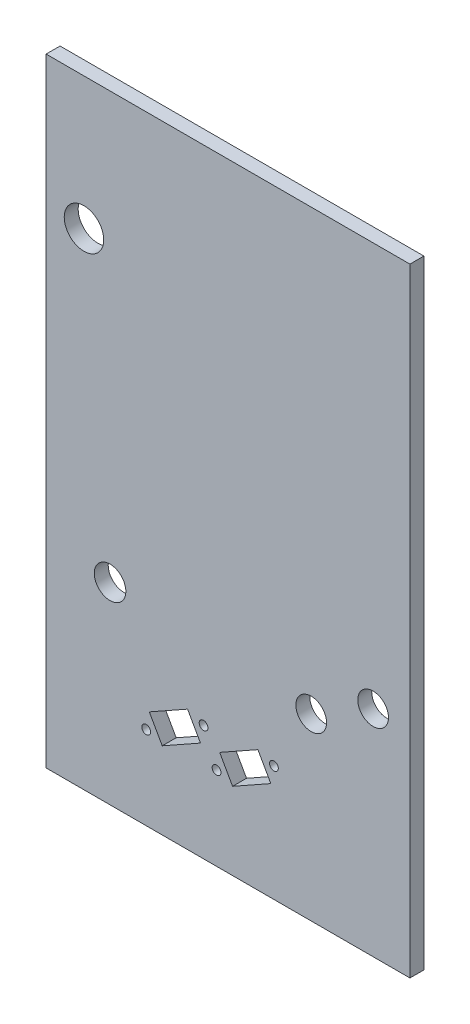
from build123d import *

# Parameters (mm, degrees)
SKETCH1_6_R         = 4.5
BEZEL_DEPTH         = 3.18
SKETCH1_W           = 89.29
SKETCH1_H           = 147.294272307
SKETCH1_R           = 1
SKETCH1_R_2         = 3.6
SKETCH1_R_3         = 3.5
BODY_DEPTH          = 3.18
BOSS_EXTRUDE1_DEPTH = 3.18
SKETCH2_W           = 89.29
SKETCH2_H           = 147.294272307
SKETCH2_W_2         = 82.93
SKETCH2_H_2         = 140.934272307
CUT_EXTRUDE1_DEPTH  = 87.202274341


with BuildPart() as part:
    # Sketch1<6> → Bezel (new body)
    with BuildSketch(Plane.XY):
        with BuildLine():
            ThreePointArc((38.386540577, 59.894300362), (37.715102994, 61.736486504), (35.921082562, 62.527668469))
            Line((35.921082562, 62.527668469), (-35.919151108, 62.527668469))
            ThreePointArc((-35.919151108, 62.527668469), (-37.740296683, 61.788836311), (-38.531924078, 59.990011631))
            Line((-38.531924078, 59.990011631), (-38.531924078, 6.918014642))
            ThreePointArc((-38.531924078, 6.918014642), (-37.763028436, 5.114330162), (-35.929301917, 4.420121791))
            Line((-35.929301917, 4.420121791), (29.997375098, 4.418014642))
            ThreePointArc((29.997375098, 4.418014642), (35.990372343, 7.41277043), (38.389642662, 13.668014642))
            Line((38.389642662, 13.668014642), (38.386540577, 59.894300362))
        make_face()
        with Locations((-32.845865311, 40.363584675)):
            Circle(SKETCH1_6_R, mode=Mode.SUBTRACT)
        Polygon((-25.059803286, 10.269774383), (-25.059803286, 56.237668469), (25.061734739, 56.237668469), (25.061734739, 10.268172398), align=None, mode=Mode.SUBTRACT)
    extrude(amount=BEZEL_DEPTH)

    # Sketch1 → Body (add)
    with BuildSketch(Plane.XY):
        with Locations((-0.006924078, 0.020532315)):
            Rectangle(SKETCH1_W, SKETCH1_H)
        with Locations((-18.654638992, -51.453563135)):
            Circle(SKETCH1_R, mode=Mode.SUBTRACT)
        Polygon((-6.289161059, -47.940024251), (-15.00491643, -52.842636648), (-17.946483868, -47.613183425), (-9.230728496, -42.710571028), align=None, mode=Mode.SUBTRACT)
        with Locations((-2.620487816, -51.433845945)):
            Circle(SKETCH1_R, mode=Mode.SUBTRACT)
        with Locations((-5.581005935, -44.099644541)):
            Circle(SKETCH1_R, mode=Mode.SUBTRACT)
        with Locations((-26.900831216, -26.517202566)):
            Circle(SKETCH1_R_2, mode=Mode.SUBTRACT)
        Polygon((9.744990117, -47.920307061), (1.029234746, -52.822919457), (-1.912332692, -47.593466234), (6.803422679, -42.690853838), align=None, mode=Mode.SUBTRACT)
        with Locations((10.453145241, -44.07992735)):
            Circle(SKETCH1_R, mode=Mode.SUBTRACT)
        with Locations((18.957561099, -29.561304194)):
            Circle(SKETCH1_R_3, mode=Mode.SUBTRACT)
        with Locations((33.068305831, -21.491722051)):
            Circle(SKETCH1_R_3, mode=Mode.SUBTRACT)
        with BuildLine():
            Line((-35.919151108, 62.527668469), (35.921082562, 62.527668469))
            ThreePointArc((35.921082562, 62.527668469), (37.715102994, 61.736486504), (38.386540577, 59.894300362))
            Line((38.386540577, 59.894300362), (38.389642662, 13.668014642))
            ThreePointArc((38.389642662, 13.668014642), (35.990372343, 7.41277043), (29.997375098, 4.418014642))
            Line((29.997375098, 4.418014642), (-35.929301917, 4.420121791))
            ThreePointArc((-35.929301917, 4.420121791), (-37.763028436, 5.114330162), (-38.531924078, 6.918014642))
            Line((-38.531924078, 6.918014642), (-38.531924078, 59.990011631))
            ThreePointArc((-38.531924078, 59.990011631), (-37.740296683, 61.788836311), (-35.919151108, 62.527668469))
        make_face(mode=Mode.SUBTRACT)
    extrude(amount=BODY_DEPTH)

    # Sketch1<11> → Boss-Extrude1 (add)
    with BuildSketch(Plane.XY):
        Polygon((25.061734739, 56.237668469), (-25.059803286, 56.237668469), (-25.059803286, 10.269774383), (25.061734739, 10.268172398), align=None)
    extrude(amount=BOSS_EXTRUDE1_DEPTH)

    # Sketch2 → Cut-Extrude1 (cut, through all)
    with BuildSketch(Plane.XY.offset(3.18)):
        with Locations((-0.006924078, 0.020532315)):
            Rectangle(SKETCH2_W, SKETCH2_H)
        with Locations((-0.006924078, 0.020532315)):
            Rectangle(SKETCH2_W_2, SKETCH2_H_2, mode=Mode.SUBTRACT)
    extrude(amount=-CUT_EXTRUDE1_DEPTH, mode=Mode.SUBTRACT)


solid = part.part
